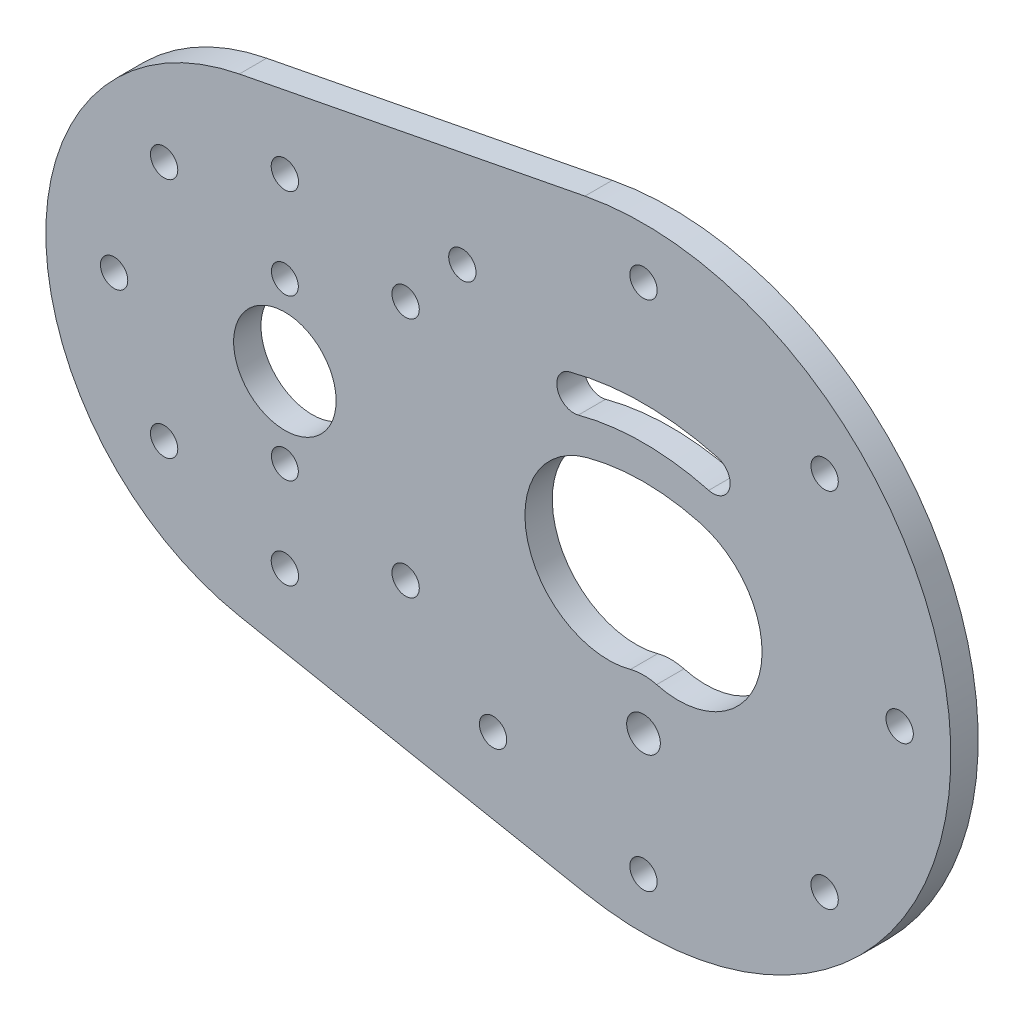
from build123d import *

# Parameters (mm, degrees)
SKETCH1_W           = 127
SKETCH1_H           = 88.9
SKETCH1_R           = 1.564880276
SKETCH1_R_2         = 4.7625
BOSS_EXTRUDE1_DEPTH = 2.54
SKETCH2_W           = 177.519600035
SKETCH2_H           = 126.718171086
CUT_EXTRUDE1_DEPTH  = 108.831991492
SKETCH4_R           = 1.27
CUT_EXTRUDE2_DEPTH  = 70.143319498
SKETCH5_R           = 1.25
CUT_EXTRUDE3_DEPTH  = 70.143319498


with BuildPart() as part:
    # Sketch1 → Boss-Extrude1 (new body)
    with BuildSketch(Plane.XY):
        with Locations((-28.03132955, 12.5)):
            Rectangle(SKETCH1_W, SKETCH1_H)
        Circle(SKETCH1_R, mode=Mode.SUBTRACT)
        with Locations((-33.3375, 12.5)):
            Circle(SKETCH1_R_2, mode=Mode.SUBTRACT)
        with BuildLine():
            ThreePointArc((5.250170212, 19.593901979), (10.755067214, 10.059140681), (1.220305916, 4.554243678))
            ThreePointArc((1.220305916, 4.554243678), (0, 4.7149), (-1.220305916, 4.554243678))
            ThreePointArc((-1.220305916, 4.554243678), (-10.755067214, 10.059140681), (-5.250170212, 19.593901979))
            ThreePointArc((-5.250170212, 19.593901979), (0, 20.2851), (5.250170212, 19.593901979))
        make_face(mode=Mode.SUBTRACT)
        with BuildLine():
            ThreePointArc((6.881351362, 25.681552906), (0, 26.5875), (-6.881351362, 25.681552906))
            ThreePointArc((-6.881351362, 25.681552906), (-8.003883377, 23.737270423), (-6.059600893, 22.614738408))
            ThreePointArc((-6.059600893, 22.614738408), (0, 23.4125), (6.059600893, 22.614738408))
            ThreePointArc((6.059600893, 22.614738408), (8.003883377, 23.737270423), (6.881351362, 25.681552906))
        make_face(mode=Mode.SUBTRACT)
    extrude(amount=BOSS_EXTRUDE1_DEPTH)

    # Sketch2 → Cut-Extrude1 (cut, through all)
    with BuildSketch(Plane.XY.offset(2.54)):
        with Locations((-18.257651528, 17.008273159)):
            Rectangle(SKETCH2_W, SKETCH2_H)
        with BuildLine():
            Line((-37.570833333, 34.318100602), (-5.442857143, 40.551843631))
            ThreePointArc((-5.442857143, 40.551843631), (28.575, 12.5), (-5.442857143, -15.551843631))
            Line((-5.442857143, -15.551843631), (-37.570833333, -9.318100602))
            ThreePointArc((-37.570833333, -9.318100602), (-55.5625, 12.5), (-37.570833333, 34.318100602))
        make_face(mode=Mode.SUBTRACT)
    extrude(amount=-CUT_EXTRUDE1_DEPTH, mode=Mode.SUBTRACT)

    # Sketch4 → Cut-Extrude2 (cut, through all)
    with BuildSketch(Plane.XY.offset(2.54)):
        with Locations((-33.3375, 28.375)):
            Circle(SKETCH4_R)
        with Locations((0, 36.3125)):
            Circle(SKETCH4_R)
        with Locations((-22.112179849, 23.725320151)):
            Circle(SKETCH4_R)
        with Locations((-13.982083803, -6.855416197)):
            Circle(SKETCH4_R)
        with Locations((-22.112179849, 1.274679849)):
            Circle(SKETCH4_R)
        with Locations((-33.3375, -3.375)):
            Circle(SKETCH4_R)
        with Locations((-44.562820151, 1.274679849)):
            Circle(SKETCH4_R)
        with Locations((-49.2125, 12.5)):
            Circle(SKETCH4_R)
        with Locations((16.837980227, 29.337980227)):
            Circle(SKETCH4_R)
        with Locations((23.8125, 12.5)):
            Circle(SKETCH4_R)
        with Locations((16.837980227, -4.337980227)):
            Circle(SKETCH4_R)
        with Locations((0, -11.3125)):
            Circle(SKETCH4_R)
        with Locations((-44.562820151, 23.725320151)):
            Circle(SKETCH4_R)
        with Locations((-16.837980227, 29.337980227)):
            Circle(SKETCH4_R)
    extrude(amount=-CUT_EXTRUDE2_DEPTH, mode=Mode.SUBTRACT)

    # Sketch5 → Cut-Extrude3 (cut, through all)
    with BuildSketch(Plane.XY.offset(2.54)):
        with Locations((-33.3375, 19.9422)):
            Circle(SKETCH5_R)
        with Locations((-33.3375, 5.0578)):
            Circle(SKETCH5_R)
    extrude(amount=-CUT_EXTRUDE3_DEPTH, mode=Mode.SUBTRACT)


solid = part.part
